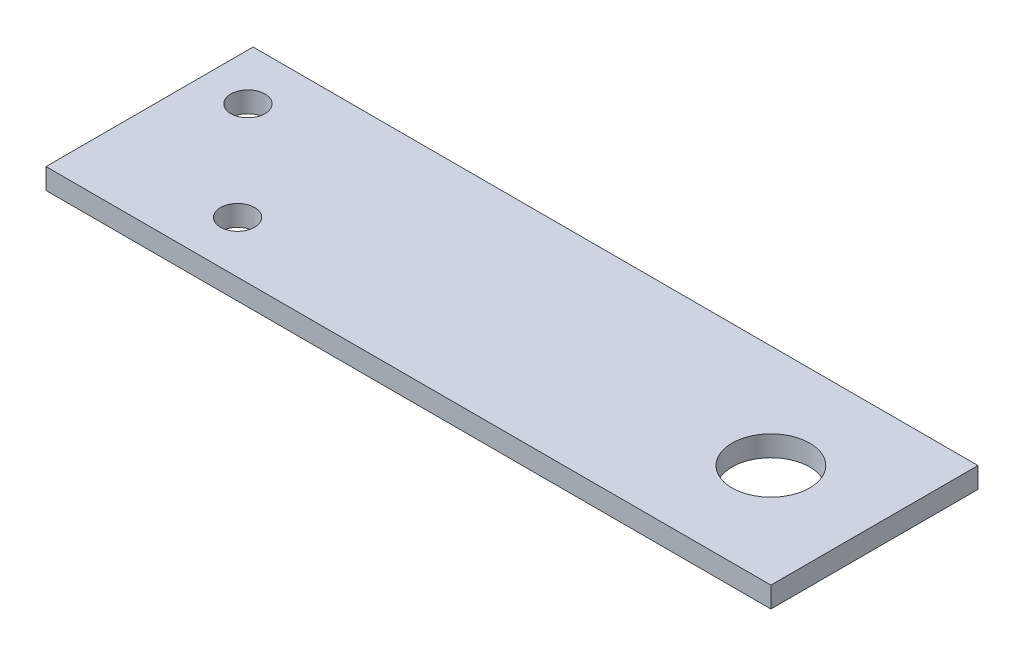
from build123d import *

# Parameters (mm, degrees)
SKETCH1_W                  = 88.9
SKETCH1_H                  = 25.4
BOSS_EXTRUDE1_DEPTH        = 3.175
SKETCH2_R                  = 4.7625
SKETCH2_R_2                = 2.0955
CUT_EXTRUDE1_DEPTH         = 3.175
CONVERT_SOLID1_OUTLINE_W   = 88.9
CONVERT_SOLID1_OUTLINE_H   = 25.4
CONVERT_SOLID1_OUTLINE_R   = 2.0955
CONVERT_SOLID1_OUTLINE_R_2 = 4.7625
CONVERT_SOLID1_DEPTH       = 0.635


# Read off the part's stored shape, not the designer's step: Convert-Solid1
with BuildPart() as part:
    # Sketch1 → Boss-Extrude1 (new body)
    with BuildSketch(Plane(origin=(0, 0, 0), x_dir=(1, 0, 0), z_dir=(0, 1, 0))):
        with Locations((44.45, 12.7)):
            Rectangle(SKETCH1_W, SKETCH1_H)
    extrude(amount=BOSS_EXTRUDE1_DEPTH)

    # Sketch2 → Cut-Extrude1 (cut)
    with BuildSketch(Plane(origin=(0, 3.175, 0), x_dir=(1, 0, 0), z_dir=(0, 1, 0))):
        with Locations(Location((76.2, 12.7, 0), (0, 0, 270))):
            Circle(SKETCH2_R)
        with Locations(Location((5.715, 19.05, 0), (0, 0, 270))):
            Circle(SKETCH2_R_2)
        with Locations(Location((17.145, 6.35, 0), (0, 0, 270))):
            Circle(SKETCH2_R_2)
    extrude(amount=-CUT_EXTRUDE1_DEPTH, mode=Mode.SUBTRACT)

    # Convert-Solid1 outline → Convert-Solid1 (cut)
    with BuildSketch(Plane(origin=(0, 0, 0), x_dir=(1, 0, 0), z_dir=(0, 1, 0))):
        with Locations((44.45, 12.7)):
            Rectangle(CONVERT_SOLID1_OUTLINE_W, CONVERT_SOLID1_OUTLINE_H)
        with Locations((17.145, 6.35)):
            Circle(CONVERT_SOLID1_OUTLINE_R, mode=Mode.SUBTRACT)
        with Locations((76.2, 12.7)):
            Circle(CONVERT_SOLID1_OUTLINE_R_2, mode=Mode.SUBTRACT)
        with Locations((5.715, 19.05)):
            Circle(CONVERT_SOLID1_OUTLINE_R, mode=Mode.SUBTRACT)
    extrude(amount=CONVERT_SOLID1_DEPTH, mode=Mode.SUBTRACT)


solid = part.part
